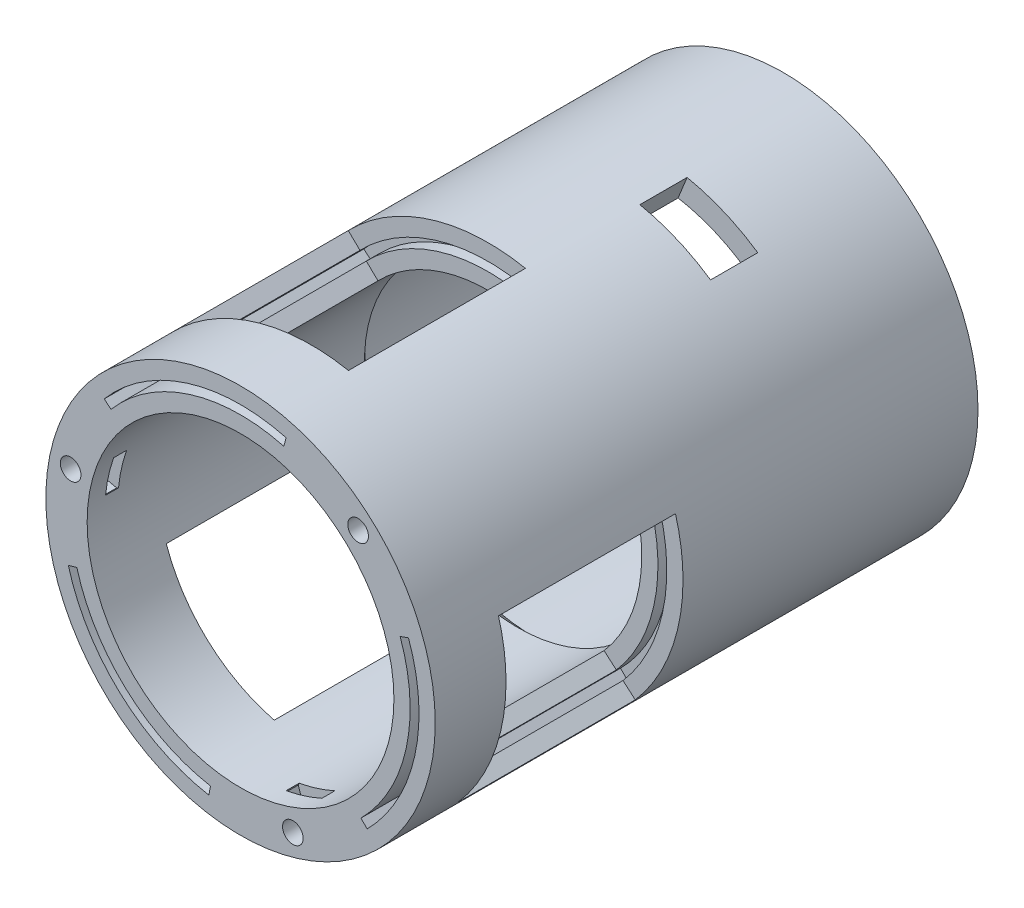
from build123d import *

# Parameters (mm, degrees)
CROQUIS1_R                          = 33
CROQUIS1_R_2                        = 29
BOSS_EXTRUDE1_DEPTH                 = 92
BOSS_EXTRUDE4_DEPTH                 = 15
SKETCH9_R                           = 1.75
CUT_EXTRUDE3_DEPTH                  = 14
SKETCH10_W                          = 7
SKETCH10_H                          = 15
SKETCH10_W_2                        = 8
SKETCH10_H_2                        = 13
CORTE_USB_Y_SWITCH_DEPTH            = 10
SKETCH11_W                          = 8
SKETCH11_H                          = 13
CUT_EXTRUDE5_DEPTH                  = 10
ALOJAMIENTO_TUERCA_DEPTH            = 2.2
ALOJAMIENTOS_TUERCAS_SUPERIOR_COUNT = 4
GROSOR_START                        = -47
SKETCH13_R                          = 29
SKETCH13_R_2                        = 26
GROSOR_ADICIONAL_DEPTH              = 47
CORTE_REVOLUCION_W                  = 30
CORTE_REVOLUCION_H                  = 8
CUT_REVOLVE3_ANGLE                  = 57
CIRPATTERN3_COUNT                   = 3
CORTE_POSTIZOS_DEPTH                = 44
CHAMFER3_SIZE                       = 3
SKETCH14_R                          = 1.75
CUT_EXTRUDE6_DEPTH                  = 17
TUERCAS_INFERIOR_DEPTH              = 2.2


with BuildPart() as part:
    # Croquis1 → Boss-Extrude1 (new body)
    with BuildSketch(Plane.XY):
        Circle(CROQUIS1_R)
        Circle(CROQUIS1_R_2, mode=Mode.SUBTRACT)
    extrude(amount=BOSS_EXTRUDE1_DEPTH)

    # Sketch8 → Boss-Extrude4 (add)
    with BuildSketch(Plane(origin=(0, 0, 0), x_dir=(-1, 0, 0), z_dir=(0, 0, -1))):
        with BuildLine():
            ThreePointArc((-4, -28.722813233), (0, -29), (4, -28.722813233))
            ThreePointArc((4, -28.722813233), (0, -26.000786616), (-4, -28.722813233))
        make_face()
        with BuildLine():
            ThreePointArc((-28.722813233, 4), (-29, 0), (-28.722813233, -4))
            ThreePointArc((-28.722813233, -4), (-26.000786616, 0), (-28.722813233, 4))
        make_face()
        with BuildLine():
            ThreePointArc((4, 28.722813233), (0, 29), (-4, 28.722813233))
            ThreePointArc((-4, 28.722813233), (0, 26.000786616), (4, 28.722813233))
        make_face()
        with BuildLine():
            ThreePointArc((28.722813233, -4), (29, 0), (28.722813233, 4))
            ThreePointArc((28.722813233, 4), (26.000786616, 0), (28.722813233, -4))
        make_face()
    extrude(amount=-BOSS_EXTRUDE4_DEPTH)

    # Sketch9 → Cut-Extrude3 (cut)
    with BuildSketch(Plane(origin=(0, 0, 0), x_dir=(-1, 0, 0), z_dir=(0, 0, -1))):
        with Locations((0, -29)):
            Circle(SKETCH9_R)
        with Locations((-29, 0)):
            Circle(SKETCH9_R)
        with Locations((0, 29)):
            Circle(SKETCH9_R)
        with Locations((29, 0)):
            Circle(SKETCH9_R)
    extrude(amount=-CUT_EXTRUDE3_DEPTH, mode=Mode.SUBTRACT)

    # Sketch10 → Corte USB y Switch (cut)
    with BuildSketch(Plane(origin=(-23.334523779, -23.334523779, 0), x_dir=(0, 0, -1), z_dir=(-0.7071067811865488, -0.7071067811865464, 0))):
        with Locations((-7, 0)):
            Rectangle(SKETCH10_W, SKETCH10_H)
        with Locations((-38, 0)):
            Rectangle(SKETCH10_W_2, SKETCH10_H_2)
    extrude(amount=-CORTE_USB_Y_SWITCH_DEPTH, mode=Mode.SUBTRACT)

    # Sketch11 → Cut-Extrude5 (cut)
    with BuildSketch(Plane(origin=(12.362017583, 30.597067201, 0), x_dir=(0, 0, -1), z_dir=(0.37460659341590646, 0.9271838545667896, 0))):
        with Locations((-26.9, -0.5)):
            Rectangle(SKETCH11_W, SKETCH11_H)
    extrude(amount=-CUT_EXTRUDE5_DEPTH, mode=Mode.SUBTRACT)

    # Tuerca → Alojamiento tuerca (cut)
    with BuildSketch(Plane(origin=(0, 0, 3), x_dir=(-1, 0, 0), z_dir=(0, 0, -1))):
        with BuildLine():
            Line((-29, -3.406366588), (-25.579878574, -3.406366588))
            ThreePointArc((-25.579878574, -3.406366588), (-23.904124497, 0), (-25.579878574, 3.406366588))
            Line((-25.579878574, 3.406366588), (-29, 3.406366588))
            Line((-29, 3.406366588), (-31.95, 1.703183294))
            Line((-31.95, 1.703183294), (-31.95, -1.703183294))
            Line((-31.95, -1.703183294), (-29, -3.406366588))
        make_face()
    alojamiento_tuerca = extrude(amount=-ALOJAMIENTO_TUERCA_DEPTH, mode=Mode.SUBTRACT)

    # Alojamientos Tuercas Superior: Alojamiento tuerca ×4 about axis
    alojamientos_tuercas_superior_axis = Axis((0, 0, 0), (0, 0, 1))
    for i in range(1, ALOJAMIENTOS_TUERCAS_SUPERIOR_COUNT):
        add(alojamiento_tuerca.rotate(alojamientos_tuercas_superior_axis, i * 360 / ALOJAMIENTOS_TUERCAS_SUPERIOR_COUNT), mode=Mode.SUBTRACT)

    # Sketch13 → Grosor adicional (add)
    with BuildSketch(Plane.XY.offset(92).offset(GROSOR_START)):
        with Locations(Location((0, 0, 0), (0, 0, 187.928141766))):
            Circle(SKETCH13_R)
        Circle(SKETCH13_R_2, mode=Mode.SUBTRACT)
    extrude(amount=GROSOR_ADICIONAL_DEPTH)

    # Corte Revolucion → Cut-Revolve3 (revolve, cut)
    with BuildSketch(Plane(origin=(0, 0, 0), x_dir=(0, 0, -1), z_dir=(0.2756373558169964, -0.9612616959383197, 0))):
        with Locations((-65, 29)):
            Rectangle(CORTE_REVOLUCION_W, CORTE_REVOLUCION_H)
    cut_revolve3 = revolve(axis=Axis((0, 0, 92), (0, 0, -1)), revolution_arc=CUT_REVOLVE3_ANGLE, mode=Mode.SUBTRACT)

    # CirPattern3: Cut-Revolve3 ×3 about axis
    cirpattern3_axis = Axis((0, 0, 0), (0, 0, 1))
    for i in range(1, CIRPATTERN3_COUNT):
        add(cut_revolve3.rotate(cirpattern3_axis, i * 360 / CIRPATTERN3_COUNT), mode=Mode.SUBTRACT)

    # Croquis2 → Corte postizos (cut)
    with BuildSketch(Plane.XY.offset(92)):
        with BuildLine():
            Line((7.72153797, 29.247911915), (7.338651789, 27.797602233))
            ThreePointArc((7.338651789, 27.797602233), (-8.645291736, 27.419362334), (-21.955521244, 18.561184955))
            Line((-21.955521244, 18.561184955), (-23.1010267, 19.529594604))
            ThreePointArc((-23.1010267, 19.529594604), (-9.096350435, 28.84993776), (7.72153797, 29.247911915))
        make_face()
        with BuildLine():
            Line((21.468665741, -21.311003996), (20.404103804, -20.254259996))
            ThreePointArc((20.404103804, -20.254259996), (28.068510205, -6.222638901), (27.052218317, 9.733446673))
            Line((27.052218317, 9.733446673), (28.463638403, 10.241278673))
            ThreePointArc((28.463638403, 10.241278673), (29.532954215, -6.547298322), (21.468665741, -21.311003996))
        make_face()
        with BuildLine():
            Line((-29.190203711, -7.936907919), (-27.742755593, -7.543342237))
            ThreePointArc((-27.742755593, -7.543342237), (-19.423218469, -21.196723433), (-5.096697073, -28.294631628))
            Line((-5.096697073, -28.294631628), (-5.362611703, -29.770873278))
            ThreePointArc((-5.362611703, -29.770873278), (-20.43660378, -22.302639439), (-29.190203711, -7.936907919))
        make_face()
    extrude(amount=-CORTE_POSTIZOS_DEPTH, mode=Mode.SUBTRACT)

    # Chamfer3
    chamfer3_edges = [part.edges().sort_by_distance(p)[0] for p in [
        (-29, 0, 45),
    ]]
    chamfer(chamfer3_edges, length=CHAMFER3_SIZE - 0.0001)  # a hair under: the kernel refuses the full size

    # Sketch14 → Cut-Extrude6 (cut)
    with BuildSketch(Plane.XY.offset(92)):
        with Locations((19.929911125, 21.749681436)):
            Circle(SKETCH14_R)
        with Locations((8.870821085, -28.134650047)):
            Circle(SKETCH14_R)
        with Locations((-28.80073221, 6.384968611)):
            Circle(SKETCH14_R)
    extrude(amount=-CUT_EXTRUDE6_DEPTH, mode=Mode.SUBTRACT)

    # Sketch15 → Tuercas inferior (cut)
    with BuildSketch(Plane.XY.offset(89)):
        with BuildLine():
            Line((17.415459305, 24.047694791), (15.108166619, 21.523089667))
            ThreePointArc((15.108166619, 21.523089667), (16.492116143, 17.98809762), (20.137070258, 16.927062957))
            Line((20.137070258, 16.927062957), (22.444362944, 19.451668081))
            Line((22.444362944, 19.451668081), (23.177274978, 22.778253911))
            Line((23.177274978, 22.778253911), (20.662823159, 25.076267266))
            Line((20.662823159, 25.076267266), (17.415459305, 24.047694791))
        make_face()
        with BuildLine():
            Line((12.118184939, -27.106077572), (11.08545911, -23.84560093))
            ThreePointArc((11.08545911, -23.84560093), (7.332091433, -23.276640352), (4.590731403, -25.90274588))
            Line((4.590731403, -25.90274588), (5.623457232, -29.163222522))
            Line((5.623457232, -29.163222522), (8.137909051, -31.461235877))
            Line((8.137909051, -31.461235877), (11.385272905, -30.432663402))
            Line((11.385272905, -30.432663402), (12.118184939, -27.106077572))
        make_face()
        with BuildLine():
            Line((-29.533644244, 3.058382781), (-26.193625729, 2.322511264))
            ThreePointArc((-26.193625729, 2.322511264), (-23.824207576, 5.288542732), (-24.727801661, 8.975682923))
            Line((-24.727801661, 8.975682923), (-28.067820176, 9.711554441))
            Line((-28.067820176, 9.711554441), (-31.31518403, 8.682981966))
            Line((-31.31518403, 8.682981966), (-32.048096064, 5.356396136))
            Line((-32.048096064, 5.356396136), (-29.533644244, 3.058382781))
        make_face()
    extrude(amount=-TUERCAS_INFERIOR_DEPTH, mode=Mode.SUBTRACT)


solid = part.part
